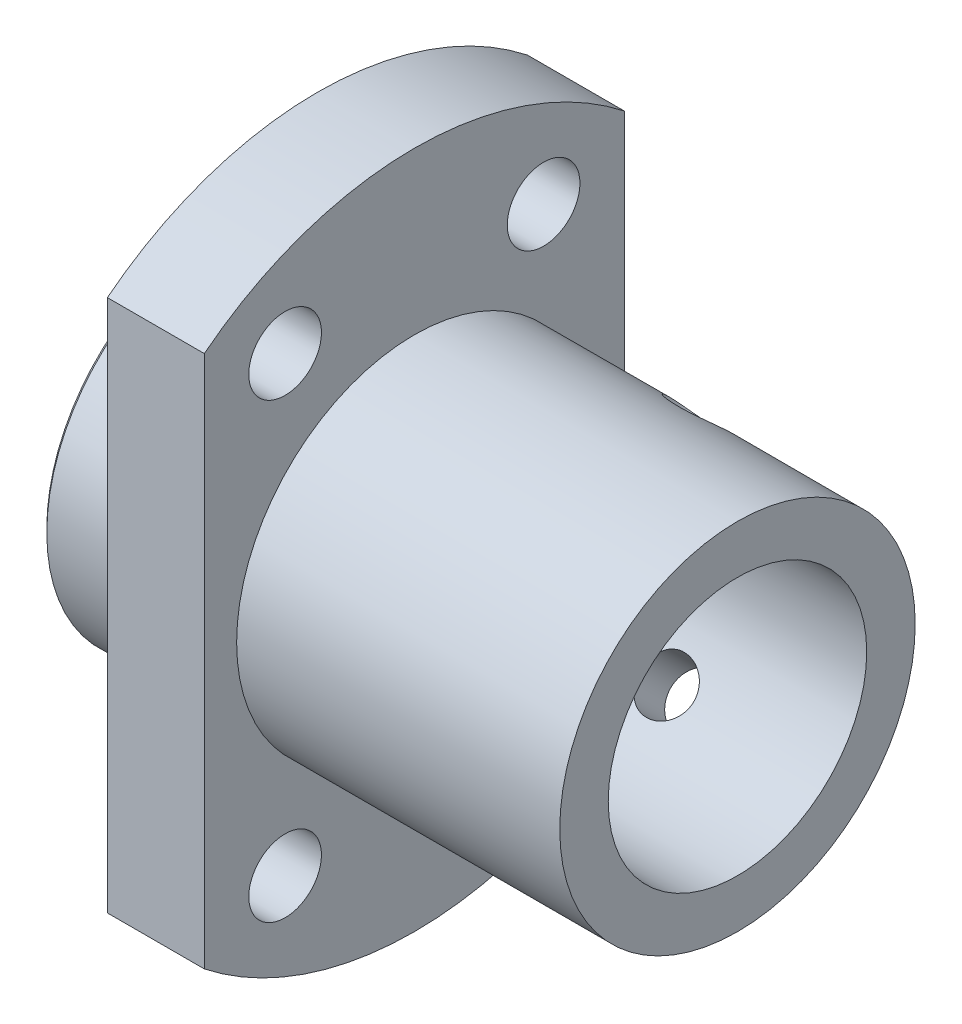
from build123d import *

# Parameters (mm, degrees)
CUT_EXTRUDE_1_DEPTH = 36.80502758
CHAMFER_1_SIZE      = 0.25
HOLE_WIZARD_1_D     = 4.5


# Read off the part's stored shape, not the designer's step: M4 螺纹孔1
with BuildPart() as part:
    # 草图2 → 旋转1 (revolve)
    with BuildSketch(Plane.XY, mode=Mode.PRIVATE) as revolve_1_sk:
        Polygon((32, 8), (32, 11), (12, 11), (12, 21), (6, 21), (6, 10.75), (5.5, 10.75), (5.5, 11), (0, 11), (0, 8), align=None)
    revolve(revolve_1_sk.sketch.rotate(Axis((0, 0, 0), (1, 0, 0)), 90), axis=Axis((0, 0, 0), (1, 0, 0)))

    # 草图3 → 切除-拉伸1 (cut, through all)
    with BuildSketch(Plane(origin=(12, 0, 0), x_dir=(0, 0, -1), z_dir=(1, 0, 0))):
        with BuildLine():
            Line((-13, -16.492422502), (-13, 16.492422502))
            ThreePointArc((-13, 16.492422502), (-21, 0), (-13, -16.492422502))
        make_face()
        with BuildLine():
            ThreePointArc((21, 0), (18.894443628, 9.16515139), (13, 16.492422502))
            Line((13, 16.492422502), (13, -16.492422502))
            ThreePointArc((13, -16.492422502), (18.894443628, -9.16515139), (21, 0))
        make_face()
    extrude(amount=-CUT_EXTRUDE_1_DEPTH, mode=Mode.SUBTRACT)

    # 倒角1
    chamfer_1_edges = [part.edges().sort_by_distance(p)[0] for p in [
        (0, 0, -11),
    ]]
    chamfer(chamfer_1_edges, length=CHAMFER_1_SIZE)

    # 孔1 (through all)
    with Locations(Plane(origin=(12, 0, 0), x_dir=(0, 0, -1), z_dir=(1, 0, 0))):
        with Locations((-8, 14), (-8, -14), (8, 14), (8, -14)):
            Hole(HOLE_WIZARD_1_D / 2)

    # M4 螺纹孔1 outline → M4 螺纹孔1 (revolve, cut)
    with BuildSketch(Plane(origin=(22, 0, 0), x_dir=(1, 0, 0), z_dir=(0, 0.707106781186546, 0.707106781186549))):
        Polygon((2.025041593, 11.000041593), (0, 11.000041593), (0, 7.827899387), (1.65, 7.827899387), (1.65, 10.625), align=None)
    revolve(axis=Axis((22, 0, 0), (0, 0.707106781186549, -0.707106781186546)), mode=Mode.SUBTRACT)

    # Hole Wizard M4 _1 2 outline → Hole Wizard M4 _1 2 (revolve, cut)
    with BuildSketch(Plane(origin=(22, 0, 0), x_dir=(1, 0, 0), z_dir=(0, -0.707106781186546, 0.707106781186549))):
        Polygon((0, -11.000091928), (2.025091928, -11.000091928), (1.65, -10.625), (1.65, -7.827899387), (0, -7.827899387), align=None)
    revolve(axis=Axis((22, 0, 0), (0, 0.707106781186549, 0.707106781186546)), mode=Mode.SUBTRACT)


solid = part.part
